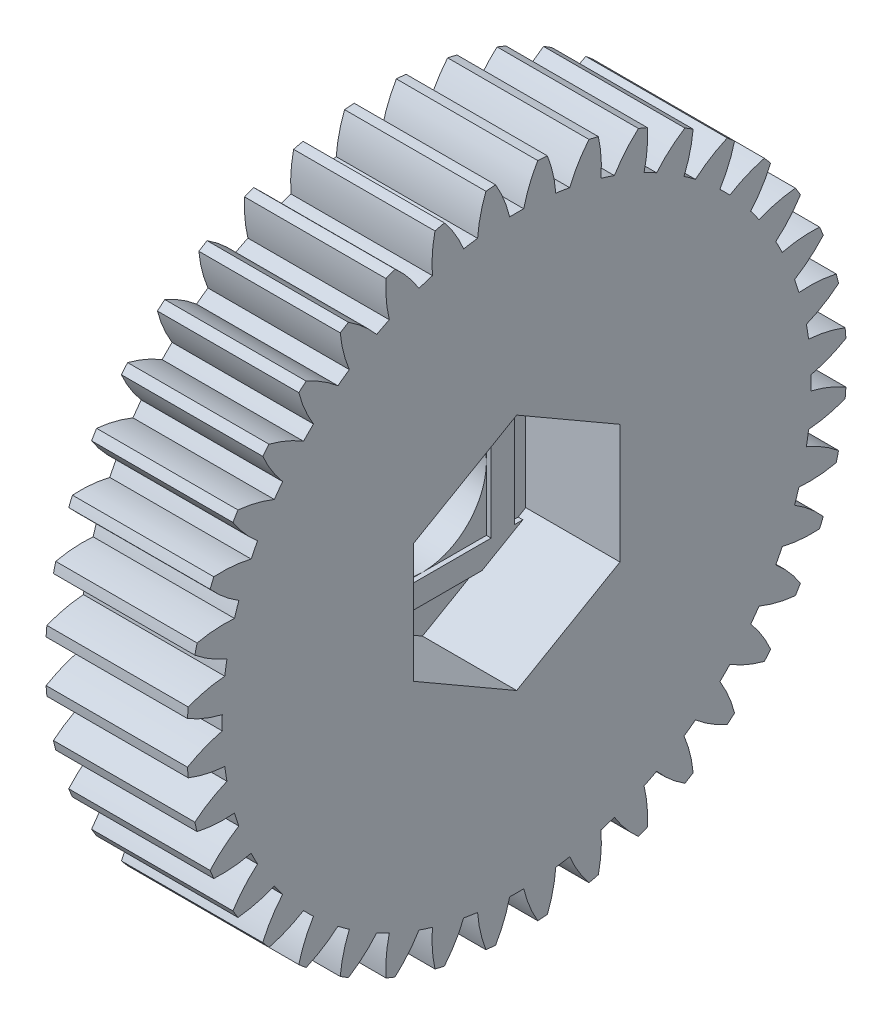
from build123d import *
from build123d.topology import SkipClean

# Parameters (mm, degrees)
BASPROSKE_W         = 9
BASPROSKE_H         = 21
TOOTHCUT_DEPTH      = 32.032241298
TEETHCUTS_COUNT     = 40
TEETHCUTS_ANGLE     = 351
BORSKE_R            = 2
BORE_DEPTH          = 50.0001016
CUT_EXTRUDE1_DEPTH  = 6
SKETCH1_7_R         = 4.075
CUT_EXTRUDE2_DEPTH  = 31.974304622
SKETCH2_R           = 6
SKETCH2_R_2         = 4.075
BOSS_EXTRUDE1_DEPTH = 1.8
SKETCH3_W           = 8.15
SKETCH3_H           = 8.15
BOSS_EXTRUDE2_DEPTH = 0.3


with BuildPart() as part:
    # BasProSke → Base-Revolve (revolve)
    with BuildSketch(Plane(origin=(0, 0, 0), x_dir=(1, 0, 0), z_dir=(0, 1, 0))):
        with Locations((4.5, 10.5)):
            Rectangle(BASPROSKE_W, BASPROSKE_H)
    revolve(axis=Axis((-10, 0, 0), (1, 0, 0)))

    # TooCutSke → ToothCut (cut, through all)
    with BuildSketch(Plane(origin=(0, 0, 0), x_dir=(0, 0, -1), z_dir=(1, 0, 0))):
        with BuildLine():
            ThreePointArc((0.448673268, 18.74363074), (0, 18.749), (-0.448673268, 18.74363074))
            ThreePointArc((-0.448673268, 18.74363074), (-0.816786816, 19.89705013), (-1.354745081, 20.981708961))
            ThreePointArc((-1.354745081, 20.981708961), (0, 21.0254), (1.354745081, 20.981708961))
            ThreePointArc((1.354745081, 20.981708961), (0.816786816, 19.89705013), (0.448673268, 18.74363074))
        make_face()
    toothcut = extrude(amount=TOOTHCUT_DEPTH, mode=Mode.SUBTRACT)

    # TeethCuts: ToothCut ×40 about axis
    teethcuts_axis = Axis((-10, 0, 0), (1, 0, 0))
    for i in range(1, TEETHCUTS_COUNT):
        add(toothcut.rotate(teethcuts_axis, i * TEETHCUTS_ANGLE / (TEETHCUTS_COUNT - 1)), mode=Mode.SUBTRACT)

    # BorSke → Bore (cut, symmetric)
    with BuildSketch(Plane(origin=(0, 0, 0), x_dir=(0, 0, -1), z_dir=(1, 0, 0))):
        Circle(BORSKE_R)
    extrude(amount=BORE_DEPTH, both=True, mode=Mode.SUBTRACT)

    # Sketch1 → Cut-Extrude1 (cut)
    with BuildSketch(Plane(origin=(9, 0, 0), x_dir=(0, 0, -1), z_dir=(1, 0, 0))):
        Polygon((0, 7.59215604), (-6.575, 3.79607802), (-6.575, -3.79607802), (0, -7.59215604), (6.575, -3.79607802), (6.575, 3.79607802), align=None)
    extrude(amount=-CUT_EXTRUDE1_DEPTH, mode=Mode.SUBTRACT)

    # Sketch1<7> → Cut-Extrude2 (cut, through all)
    with BuildSketch(Plane(origin=(9, 0, 0), x_dir=(0, 0, -1), z_dir=(1, 0, 0))):
        Circle(SKETCH1_7_R)
    extrude(amount=-CUT_EXTRUDE2_DEPTH, mode=Mode.SUBTRACT)

    # Sketch2 → Boss-Extrude1 (add)
    with SkipClean():  # the faces are left unmerged after this step: merging them gives an invalid solid
        with BuildSketch(Plane.ZY):
            Circle(SKETCH2_R)
            Circle(SKETCH2_R_2, mode=Mode.SUBTRACT)
        extrude(amount=BOSS_EXTRUDE1_DEPTH)

    # Sketch3 → Boss-Extrude2 (add)
    with SkipClean():  # the faces are left unmerged after this step: merging them gives an invalid solid
        with BuildSketch(Plane(origin=(3, 0, 0), x_dir=(0, 0, -1), z_dir=(1, 0, 0))):
            Polygon((5.575, -4.075), (5.575, 4.075), (6.091892959, 4.075), (3.493816748, 5.575), (-3.493816748, 5.575), (-6.091892959, 4.075), (-5.575, 4.075), (-5.575, -4.075), (-6.091892959, -4.075), (-3.493816748, -5.575), (3.493816748, -5.575), (6.091892959, -4.075), align=None)
            Rectangle(SKETCH3_W, SKETCH3_H, mode=Mode.SUBTRACT)
        extrude(amount=BOSS_EXTRUDE2_DEPTH)


solid = part.part
